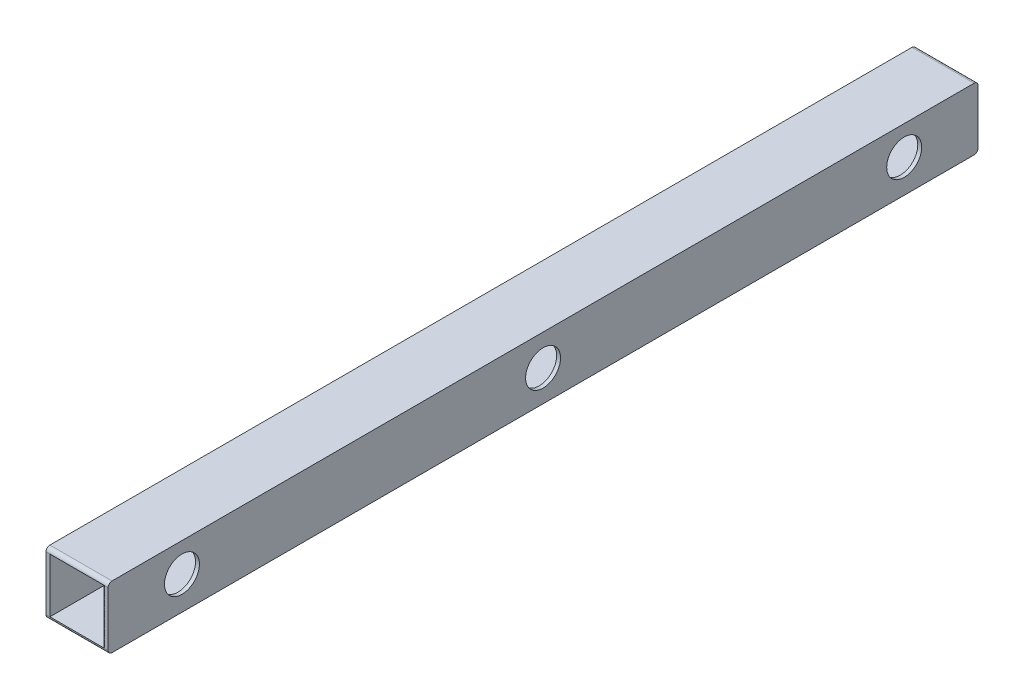
from build123d import *

# Parameters (mm, degrees)
BOSS_EXTRUDE1_DEPTH      = 355.6
BOSS_EXTRUDE1_DEPTH_BACK = 355.6
SKETCH1_W                = 50.8
SKETCH1_H                = 50.8
SKETCH1_W_2              = 44.45
SKETCH1_H_2              = 44.45
SKETCH2_R                = 14.2875
CUT_EXTRUDE1_DEPTH       = 361.10715072
FILLET1_R                = 3.175


with BuildPart() as part:
    # Sketch1 → Boss-Extrude1 (new, two sides: drawn at the far end of the back side and taken through both)
    with BuildSketch(Plane.XY.offset(-BOSS_EXTRUDE1_DEPTH_BACK)):
        Rectangle(SKETCH1_W, SKETCH1_H)
        Rectangle(SKETCH1_W_2, SKETCH1_H_2, mode=Mode.SUBTRACT)
    extrude(amount=BOSS_EXTRUDE1_DEPTH + BOSS_EXTRUDE1_DEPTH_BACK)

    # Sketch2 → Cut-Extrude1 (cut, through all)
    with BuildSketch(Plane.ZY.offset(25.4)):
        with Locations((-295.240391678, 1.5875)):
            Circle(SKETCH2_R)
        Circle(SKETCH2_R)
        with Locations((295.240391678, 1.5875)):
            Circle(SKETCH2_R)
    extrude(amount=-CUT_EXTRUDE1_DEPTH, mode=Mode.SUBTRACT)

    # Fillet1
    fillet1_edges = [part.edges().sort_by_distance(p)[0] for p in [
        (0, -25.4, -355.6),
        (0, 25.4, 355.6),
        (0, -25.4, 355.6),
        (0, 25.4, -355.6),
    ]]
    fillet(fillet1_edges, radius=FILLET1_R - 0.0001)  # a hair under: the kernel refuses the full size


solid = part.part
